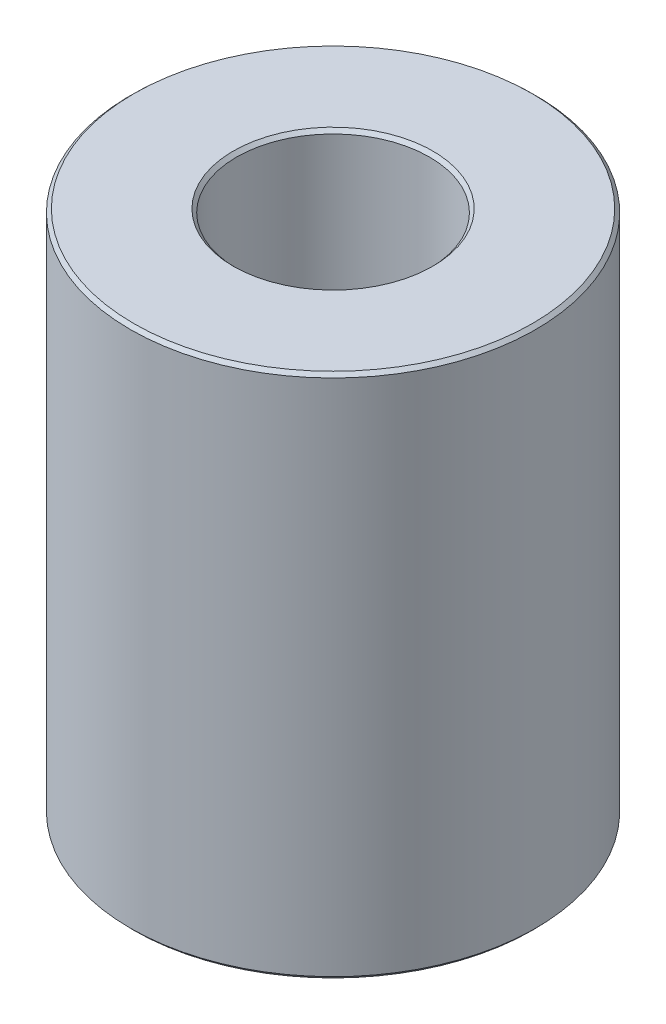
from build123d import *
from OCP.BRepFilletAPI import BRepFilletAPI_MakeChamfer

# Parameters (mm, degrees)
SKETCH1_R           = 60
BOSS_EXTRUDE1_DEPTH = 155.502326558
SKETCH2_R           = 28.54991543
CUT_EXTRUDE1_DEPTH  = 178.146757139
CHAMFER1_SIZE       = 0.99477309
CHAMFER1_SIZE2      = 1.040657195


with BuildPart() as part:
    # Sketch1 → Boss-Extrude1 (new body)
    with BuildSketch(Plane(origin=(0, 0, 0), x_dir=(1, 0, 0), z_dir=(0, 1, 0))):
        Circle(SKETCH1_R)
    extrude(amount=BOSS_EXTRUDE1_DEPTH)

    # Sketch2 → Cut-Extrude1 (cut, through all)
    with BuildSketch(Plane(origin=(0, 0, 0), x_dir=(1, 0, 0), z_dir=(0, 1, 0))):
        Circle(SKETCH2_R)
    extrude(amount=CUT_EXTRUDE1_DEPTH, mode=Mode.SUBTRACT)

    # Chamfer1: one chamfer whose edges measure the first distance from different faces: ONE call of the kernel's chamfer builder (chamfer() names one face for all edges)
    chamfer1_edges_1 = [part.edges().sort_by_distance(p)[0] for p in [
        (-28.54991543, 155.502326558, 0),
    ]]
    chamfer1_side_1 = [part.faces().sort_by_distance(p)[0] for p in [
        (-58.302943725, 155.502326558, 0),
    ]]
    chamfer1_edges_2 = [part.edges().sort_by_distance(p)[0] for p in [
        (-28.54991543, 0, 0),
    ]]
    chamfer1_side_2 = [part.faces().sort_by_distance(p)[0] for p in [
        (-28.54991543, 77.751163279, 0),
    ]]
    chamfer1_edges_3 = [part.edges().sort_by_distance(p)[0] for p in [
        (-60, 0, 0),
    ]]
    chamfer1_side_3 = [part.faces().sort_by_distance(p)[0] for p in [
        (-58.302943725, 0, 0),
    ]]
    chamfer1_edges_4 = [part.edges().sort_by_distance(p)[0] for p in [
        (-60, 155.502326558, 0),
    ]]
    chamfer1_side_4 = [part.faces().sort_by_distance(p)[0] for p in [
        (-60, 77.751163279, 0),
    ]]
    chamfer1 = BRepFilletAPI_MakeChamfer(part.part.solid().wrapped)
    for e in chamfer1_edges_1:
        chamfer1.Add(CHAMFER1_SIZE, CHAMFER1_SIZE2, e.wrapped, chamfer1_side_1[0].wrapped)  # the first distance lies on this face
    for e in chamfer1_edges_2:
        chamfer1.Add(CHAMFER1_SIZE, CHAMFER1_SIZE2, e.wrapped, chamfer1_side_2[0].wrapped)  # the first distance lies on this face
    for e in chamfer1_edges_3:
        chamfer1.Add(CHAMFER1_SIZE, CHAMFER1_SIZE2, e.wrapped, chamfer1_side_3[0].wrapped)  # the first distance lies on this face
    for e in chamfer1_edges_4:
        chamfer1.Add(CHAMFER1_SIZE, CHAMFER1_SIZE2, e.wrapped, chamfer1_side_4[0].wrapped)  # the first distance lies on this face
    add(Compound.cast(chamfer1.Shape()), mode=Mode.REPLACE)


solid = part.part
